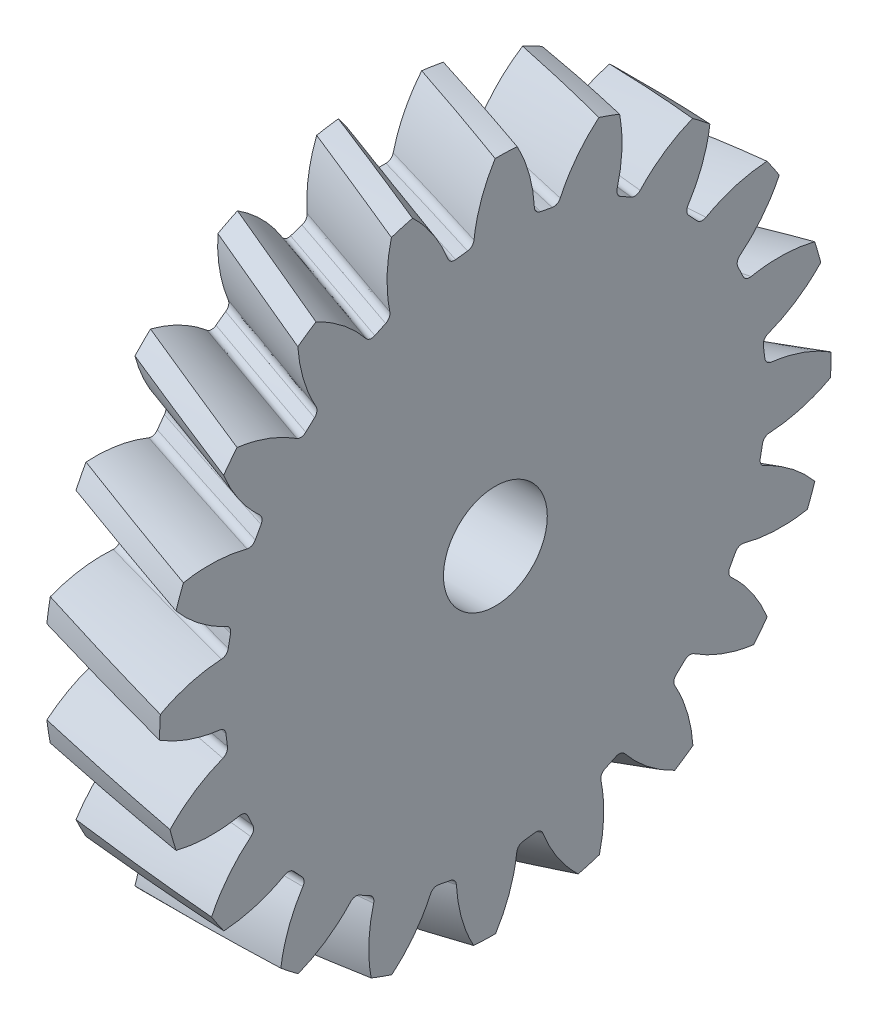
from build123d import *

# Parameters (mm, degrees)
BASPROSKE_W            = 5
BASPROSKE_H            = 14.552222156
TOOTHCUTRH_PITCH       = 251.213697794
TOOTHCUTRH_HEIGHT      = 5
TOOTHCUTRH_RADIUS      = 14.552222156
TOOTHCUTRH_START_ANGLE = -90
TEETHCUTSRH_COUNT      = 20
TEETHCUTSRH_ANGLE      = 342
BORSKE_R               = 0.4
BORE_DEPTH             = 62.5000025
SKETCH3_R              = 2.25
CUT_EXTRUDE1_DEPTH     = 22.178629469


with BuildPart() as part:
    # BasProSke → Base-Revolve (revolve)
    with BuildSketch(Plane(origin=(0, 0, 0), x_dir=(1, 0, 0), z_dir=(0, 1, 0)), mode=Mode.PRIVATE) as base_revolve_sk:
        with Locations((2.5, 7.276111078)):
            Rectangle(BASPROSKE_W, BASPROSKE_H)
    revolve(base_revolve_sk.sketch.rotate(Axis((-10, 0, 0), (1, 0, 0)), 180), axis=Axis((-10, 0, 0), (1, 0, 0)))

    # ToothCutRH: sweep along a helix
    with BuildLine() as toothcutrh_path:
        add(Helix(TOOTHCUTRH_PITCH, TOOTHCUTRH_HEIGHT, TOOTHCUTRH_RADIUS, center=(0, 0, 0), direction=(1, 0, 0), mode=Mode.PRIVATE).rotate(Axis((0, 0, 0), (1, 0, 0)), TOOTHCUTRH_START_ANGLE))
    # TooCutSkeRH → ToothCutRH (sweep, cut)
    with BuildSketch(Plane(origin=(0, 0, 0), x_dir=(0, 0, -1), z_dir=(1, 0, 0))):
        with BuildLine():
            ThreePointArc((0.259377145, 11.73685647), (0, 11.739722156), (-0.259377145, 11.73685647))
            ThreePointArc((-0.259377145, 11.73685647), (-0.456880733, 11.801357046), (-0.57067814, 11.975190707))
            ThreePointArc((-0.57067814, 11.975190707), (-1.173068781, 13.509502704), (-2.155624332, 14.832972529))
            ThreePointArc((-2.155624332, 14.832972529), (0, 14.988788821), (2.155624332, 14.832972529))
            ThreePointArc((2.155624332, 14.832972529), (1.173068781, 13.509502704), (0.57067814, 11.975190707))
            ThreePointArc((0.57067814, 11.975190707), (0.456880733, 11.801357046), (0.259377145, 11.73685647))
        make_face()
    toothcutrh = sweep(path=toothcutrh_path.line, is_frenet=True, mode=Mode.SUBTRACT)

    # TeethCutsRH: ToothCutRH ×20 about axis
    teethcutsrh_axis = Axis((-10, 0, 0), (1, 0, 0))
    for i in range(1, TEETHCUTSRH_COUNT):
        add(toothcutrh.rotate(teethcutsrh_axis, i * TEETHCUTSRH_ANGLE / (TEETHCUTSRH_COUNT - 1)), mode=Mode.SUBTRACT)

    # BorSke → Bore (cut, symmetric)
    with BuildSketch(Plane(origin=(0, 0, 0), x_dir=(0, 0, -1), z_dir=(1, 0, 0))):
        with Locations(Location((0, 0, 0), (0, 0, 180))):
            Circle(BORSKE_R)
    extrude(amount=BORE_DEPTH, both=True, mode=Mode.SUBTRACT)

    # Sketch3 → Cut-Extrude1 (cut, through all)
    with BuildSketch(Plane(origin=(5, 0, 0), x_dir=(0, 0, -1), z_dir=(1, 0, 0))):
        Circle(SKETCH3_R)
    extrude(amount=-CUT_EXTRUDE1_DEPTH, mode=Mode.SUBTRACT)


solid = part.part
